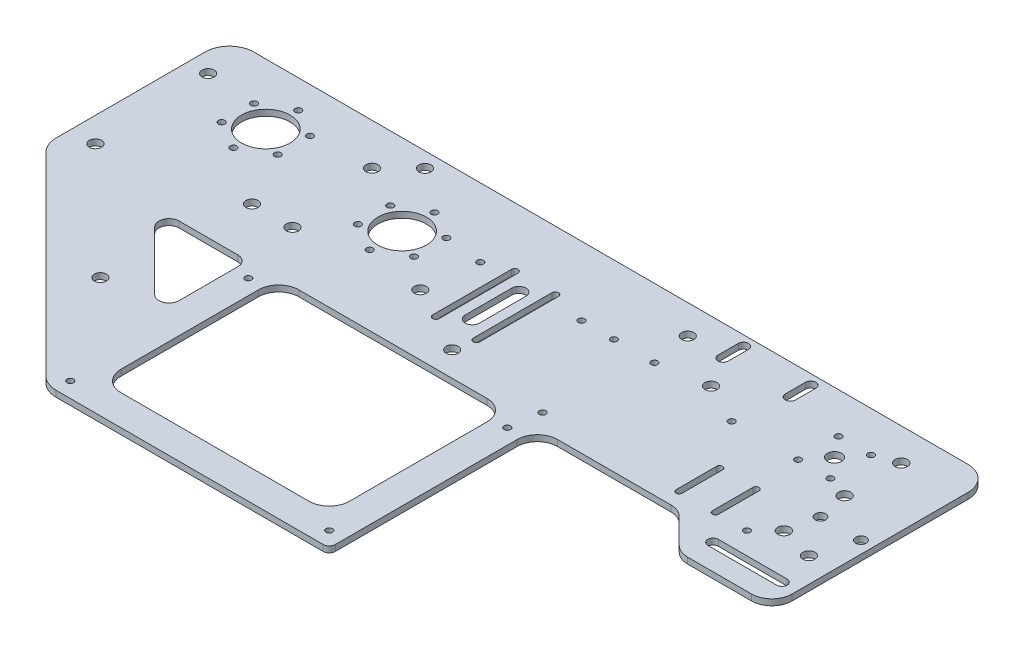
from build123d import *

# Parameters (mm, degrees)
ESBO_O1_R                = 1.6
ESBO_O1_R_2              = 3
ESBO_O1_R_3              = 12
ESBO_O1_R_4              = 3.5
ESBO_O1_R_5              = 3.05
RESSALTO_EXTRUS_O1_DEPTH = 3
ESBO_O2_R                = 3
ESBO_O2_R_2              = 2.6
CORTE_EXTRUS_O1_DEPTH    = 10
RESSALTO_EXTRUS_O2_START = -3
RESSALTO_EXTRUS_O2_DEPTH = 3
FILETE1_R                = 10
CORTE_EXTRUS_O2_DEPTH    = 244.227671166


# Read off the part's stored shape, not the designer's step: Ressalto-extrusão2
with BuildPart() as part:
    # Esboço1 → Ressalto-extrusão1 (new body)
    with BuildSketch(Plane(origin=(0, 0, 0), x_dir=(1, 0, 0), z_dir=(0, 1, 0))):
        with BuildLine():
            Line((-80.557360207, -153.648697641), (51.472077044, -153.648697641))
            ThreePointArc((51.472077044, -153.648697641), (53.593397388, -152.770017984), (54.472077044, -150.648697641))
            Line((54.472077044, -150.648697641), (54.472077044, -60.788592817))
            ThreePointArc((54.472077044, -60.788592817), (57.401009232, -53.717525005), (64.472077044, -50.788592817))
            Line((64.472077044, -50.788592817), (178.527922956, -50.788592817))
            ThreePointArc((178.527922956, -50.788592817), (185.598990768, -47.859660628), (188.527922956, -40.788592817))
            Line((188.527922956, -40.788592817), (188.527922956, 28))
            ThreePointArc((188.527922956, 28), (185.01320433, 36.485281374), (176.527922956, 40))
            Line((176.527922956, 40), (-176.527922956, 40))
            ThreePointArc((-176.527922956, 40), (-185.01320433, 36.485281374), (-188.527922956, 28))
            Line((-188.527922956, 28), (-188.527922956, -45.678134892))
            ThreePointArc((-188.527922956, -45.678134892), (-187.614477346, -50.270336081), (-185.01320433, -54.163416267))
            Line((-185.01320433, -54.163416267), (-89.042641582, -150.133979015))
            ThreePointArc((-89.042641582, -150.133979015), (-85.149561396, -152.735252031), (-80.557360207, -153.648697641))
        make_face()
        with Locations(Location((-81.027922956, -58.148697641, 0), (0, 0, 90))):
            Circle(ESBO_O1_R, mode=Mode.SUBTRACT)
        with Locations(Location((-81.027922956, -146.148697641, 0), (0, 0, 90))):
            Circle(ESBO_O1_R, mode=Mode.SUBTRACT)
        with Locations(Location((46.972077044, -58.148697641, 0), (0, 0, 90))):
            Circle(ESBO_O1_R, mode=Mode.SUBTRACT)
        with Locations(Location((46.972077044, -146.148697641, 0), (0, 0, 90))):
            Circle(ESBO_O1_R, mode=Mode.SUBTRACT)
        with Locations(Location((176.311042956, -38.431817641, 0), (0, 0, 90))):
            Circle(ESBO_O1_R_2, mode=Mode.SUBTRACT)
        with Locations(Location((0, -38.431817641, 0), (0, 0, 90))):
            Circle(ESBO_O1_R_2, mode=Mode.SUBTRACT)
        with Locations(Location((-140.527922956, 10, 0), (0, 0, 90))):
            Circle(ESBO_O1_R_3, mode=Mode.SUBTRACT)
        with Locations(Location((-140.527922956, -6, 0), (0, 0, 270))):
            Circle(ESBO_O1_R, mode=Mode.SUBTRACT)
        with Locations(Location((-154.384329416, 2, 0), (0, 0, 270))):
            Circle(ESBO_O1_R, mode=Mode.SUBTRACT)
        with Locations(Location((-154.384329416, 18, 0), (0, 0, 270))):
            Circle(ESBO_O1_R, mode=Mode.SUBTRACT)
        with Locations(Location((-84.367438628, 32.5, 0), (0, 0, 90))):
            Circle(ESBO_O1_R_2, mode=Mode.SUBTRACT)
        with Locations(Location((-176.311042956, -38.431817641, 0), (0, 0, 90))):
            Circle(ESBO_O1_R_2, mode=Mode.SUBTRACT)
        with Locations(Location((140.527922956, 10, 0), (0, 0, 90))):
            Circle(ESBO_O1_R_4, mode=Mode.SUBTRACT)
        with Locations(Location((148.527922956, 0, 0), (0, 0, 90))):
            Circle(ESBO_O1_R, mode=Mode.SUBTRACT)
        with Locations(Location((148.527922956, 20, 0), (0, 0, 90))):
            Circle(ESBO_O1_R, mode=Mode.SUBTRACT)
        with Locations(Location((132.527922956, 0, 0), (0, 0, 90))):
            Circle(ESBO_O1_R, mode=Mode.SUBTRACT)
        with Locations(Location((132.527922956, 20, 0), (0, 0, 90))):
            Circle(ESBO_O1_R, mode=Mode.SUBTRACT)
        with Locations(Location((-140.527922956, 26, 0), (0, 0, 270))):
            Circle(ESBO_O1_R, mode=Mode.SUBTRACT)
        with Locations(Location((-126.671516495, 18, 0), (0, 0, 270))):
            Circle(ESBO_O1_R, mode=Mode.SUBTRACT)
        with Locations(Location((-126.671516495, 2, 0), (0, 0, 270))):
            Circle(ESBO_O1_R, mode=Mode.SUBTRACT)
        with Locations(Location((-63.17160518, -16, 0), (0, 0, 270))):
            Circle(ESBO_O1_R, mode=Mode.SUBTRACT)
        with Locations(Location((-77.02801164, -8, 0), (0, 0, 270))):
            Circle(ESBO_O1_R, mode=Mode.SUBTRACT)
        with Locations(Location((-77.02801164, 8, 0), (0, 0, 270))):
            Circle(ESBO_O1_R, mode=Mode.SUBTRACT)
        with Locations(Location((-63.17160518, 16, 0), (0, 0, 270))):
            Circle(ESBO_O1_R, mode=Mode.SUBTRACT)
        with Locations(Location((-49.315198719, 8, 0), (0, 0, 270))):
            Circle(ESBO_O1_R, mode=Mode.SUBTRACT)
        with Locations(Location((-49.315198719, -8, 0), (0, 0, 270))):
            Circle(ESBO_O1_R, mode=Mode.SUBTRACT)
        with Locations(Location((-63.17160518, 0, 0), (0, 0, 270))):
            Circle(ESBO_O1_R_3, mode=Mode.SUBTRACT)
        with Locations(Location((-33.527922956, -20.648697641, 0), (0, 0, 270))):
            Circle(ESBO_O1_R_2, mode=Mode.SUBTRACT)
        with Locations(Location((79.527922956, 10, 0), (0, 0, 270))):
            Circle(ESBO_O1_R_2, mode=Mode.SUBTRACT)
        with Locations(Location((99.722077044, 0, 0), (0, 0, 270))):
            Circle(ESBO_O1_R, mode=Mode.SUBTRACT)
        with Locations(Location((49.222077044, -43, 0), (0, 0, 270))):
            Circle(ESBO_O1_R, mode=Mode.SUBTRACT)
        with Locations(Location((-30.527922956, 6, 0), (0, 0, 270))):
            Circle(ESBO_O1_R, mode=Mode.SUBTRACT)
        with Locations(Location((19.472077044, 6, 0), (0, 0, 270))):
            Circle(ESBO_O1_R, mode=Mode.SUBTRACT)
        with Locations(Location((55.527922956, 6, 0), (0, 0, 270))):
            Circle(ESBO_O1_R, mode=Mode.SUBTRACT)
        with Locations(Location((35.527922956, 6, 0), (0, 0, 270))):
            Circle(ESBO_O1_R, mode=Mode.SUBTRACT)
        with Locations(Location((159.467922956, 24.07, 0), (0, 0, 270))):
            Circle(ESBO_O1_R_5, mode=Mode.SUBTRACT)
        with Locations(Location((159.467922956, -3.93, 0), (0, 0, 270))):
            Circle(ESBO_O1_R_5, mode=Mode.SUBTRACT)
        with Locations(Location((159.467922956, -33.93, 0), (0, 0, 270))):
            Circle(ESBO_O1_R_5, mode=Mode.SUBTRACT)
        with Locations(Location((-178.527922956, 19.5, 0), (0, 0, 270))):
            Circle(ESBO_O1_R_2, mode=Mode.SUBTRACT)
        with Locations(Location((-97.527922956, 19.5, 0), (0, 0, 270))):
            Circle(ESBO_O1_R_2, mode=Mode.SUBTRACT)
        with Locations(Location((52.327922956, 25.68, 0), (0, 0, 270))):
            Circle(ESBO_O1_R_2, mode=Mode.SUBTRACT)
        with Locations(Location((150.222077044, -43, 0), (0, 0, 270))):
            Circle(ESBO_O1_R, mode=Mode.SUBTRACT)
        with BuildLine():
            Line((-122.576844598, -50.788592817), (-93.527922956, -50.788592817))
            ThreePointArc((-93.527922956, -50.788592817), (-89.99238905, -52.253058911), (-88.527922956, -55.788592817))
            Line((-88.527922956, -55.788592817), (-88.527922956, -84.837514459))
            ThreePointArc((-88.527922956, -84.837514459), (-91.614505794, -89.456912121), (-97.063456862, -88.373048365))
            Line((-97.063456862, -88.373048365), (-126.112378504, -59.324126723))
            ThreePointArc((-126.112378504, -59.324126723), (-127.196242261, -53.875175655), (-122.576844598, -50.788592817))
        make_face(mode=Mode.SUBTRACT)
        with BuildLine():
            Line((39.472077044, -60.648697641), (39.472077044, -128.648697641))
            ThreePointArc((39.472077044, -128.648697641), (36.543144856, -135.719765453), (29.472077044, -138.648697641))
            Line((29.472077044, -138.648697641), (-63.527922956, -138.648697641))
            ThreePointArc((-63.527922956, -138.648697641), (-70.598990768, -135.719765453), (-73.527922956, -128.648697641))
            Line((-73.527922956, -128.648697641), (-73.527922956, -60.648697641))
            ThreePointArc((-73.527922956, -60.648697641), (-70.598990768, -53.577629829), (-63.527922956, -50.648697641))
            Line((-63.527922956, -50.648697641), (29.472077044, -50.648697641))
            ThreePointArc((29.472077044, -50.648697641), (36.543144856, -53.577629829), (39.472077044, -60.648697641))
        make_face(mode=Mode.SUBTRACT)
        with BuildLine():
            Line((133.222077044, -43), (133.222077044, -23))
            ThreePointArc((133.222077044, -23), (134.722077044, -21.5), (136.222077044, -23))
            Line((136.222077044, -23), (136.222077044, -43))
            ThreePointArc((136.222077044, -43), (134.722077044, -44.5), (133.222077044, -43))
        make_face(mode=Mode.SUBTRACT)
        with BuildLine():
            Line((118.222077044, -43), (118.222077044, -23))
            ThreePointArc((118.222077044, -23), (116.722077044, -21.5), (115.222077044, -23))
            Line((115.222077044, -23), (115.222077044, -43))
            ThreePointArc((115.222077044, -43), (116.722077044, -44.5), (118.222077044, -43))
        make_face(mode=Mode.SUBTRACT)
        with BuildLine():
            Line((67.977922956, 25), (67.977922956, 35))
            ThreePointArc((67.977922956, 35), (70.527922956, 37.55), (73.077922956, 35))
            Line((73.077922956, 35), (73.077922956, 25))
            ThreePointArc((73.077922956, 25), (70.527922956, 22.45), (67.977922956, 25))
        make_face(mode=Mode.SUBTRACT)
        with BuildLine():
            Line((101.227922956, 25), (101.227922956, 35))
            ThreePointArc((101.227922956, 35), (103.777922956, 37.55), (106.327922956, 35))
            Line((106.327922956, 35), (106.327922956, 25))
            ThreePointArc((106.327922956, 25), (103.777922956, 22.45), (101.227922956, 25))
        make_face(mode=Mode.SUBTRACT)
    extrude(amount=-RESSALTO_EXTRUS_O1_DEPTH)

    # Esboço2 → Corte-extrusão1 (cut)
    with BuildSketch(Plane(origin=(0, 0, 0), x_dir=(1, 0, 0), z_dir=(0, 1, 0))):
        with Locations(Location((-117.838060117, -94.468502794, 0), (0, 0, 270))):
            Circle(ESBO_O2_R)
        with Locations(Location((182.527922956, -18.93, 0), (0, 0, 270))):
            Circle(ESBO_O2_R_2)
        with Locations(Location((162.527922956, -18.93, 0), (0, 0, 270))):
            Circle(ESBO_O2_R_2)
        with Locations(Location((-111.849764068, -25.5, 0), (0, 0, 270))):
            Circle(ESBO_O2_R)
        with Locations(Location((-91.849764068, -25.5, 0), (0, 0, 270))):
            Circle(ESBO_O2_R)
    extrude(amount=-CORTE_EXTRUS_O1_DEPTH, mode=Mode.SUBTRACT)

    # Ressalto-extrusão2 outline → Ressalto-extrusão2 (add)
    with BuildSketch(Plane(origin=(0, 0, 0), x_dir=(1, 0, 0), z_dir=(0, 1, 0)).offset(RESSALTO_EXTRUS_O2_START)):
        with BuildLine():
            Line((142.785787332, -68.988592817), (188.527922956, -68.988592817))
            Line((188.527922956, -68.988592817), (188.527922956, -40.788592817))
            ThreePointArc((188.527922956, -40.788592817), (185.598990767, -47.859660628), (178.527922956, -50.788592817))
            Line((178.527922956, -50.788592817), (124.585787332, -50.788592817))
            Line((124.585787332, -50.788592817), (142.785787332, -68.988592817))
        make_face()
        with BuildLine():
            ThreePointArc((146.927922956, -58.988592817), (144.327922956, -56.388592817), (146.927922956, -53.788592817))
            Line((146.927922956, -53.788592817), (180.927922956, -53.788592817))
            ThreePointArc((180.927922956, -53.788592817), (183.527922956, -56.388592817), (180.927922956, -58.988592817))
            Line((180.927922956, -58.988592817), (146.927922956, -58.988592817))
        make_face(mode=Mode.SUBTRACT)
    extrude(amount=RESSALTO_EXTRUS_O2_DEPTH)

    # Filete1
    filete1_edges = [part.edges().sort_by_distance(p)[0] for p in [
        (124.585787332, -1.5, 50.788592817),
        (188.527922956, -1.5, 68.988592817),
        (142.785787332, -1.5, 68.988592817),
    ]]
    fillet(filete1_edges, radius=FILETE1_R)

    # Esboço4 → Corte-extrusão2 (cut, through all)
    with BuildSketch(Plane(origin=(0, 0, 0), x_dir=(1, 0, 0), z_dir=(0, 1, 0))):
        with BuildLine():
            Line((-4.67160518, 2.700055346), (-4.67160518, -20.299944654))
            ThreePointArc((-4.67160518, -20.299944654), (-8.17160518, -23.799944654), (-11.67160518, -20.299944654))
            Line((-11.67160518, -20.299944654), (-11.67160518, 2.700055346))
            ThreePointArc((-11.67160518, 2.700055346), (-8.17160518, 6.200055346), (-4.67160518, 2.700055346))
        make_face()
        with BuildLine():
            Line((3.42839482, 10.700055346), (3.42839482, -12.299944654))
            ThreePointArc((3.42839482, -12.299944654), (1.82839482, -13.899944654), (0.22839482, -12.299944654))
            Line((0.22839482, -12.299944654), (0.22839482, 10.700055346))
            ThreePointArc((0.22839482, 10.700055346), (1.82839482, 12.300055346), (3.42839482, 10.700055346))
        make_face()
        with BuildLine():
            Line((3.42839482, -5.299944654), (3.42839482, -28.299944654))
            ThreePointArc((3.42839482, -28.299944654), (1.82839482, -29.899944654), (0.22839482, -28.299944654))
            Line((0.22839482, -28.299944654), (0.22839482, -5.299944654))
            ThreePointArc((0.22839482, -5.299944654), (1.82839482, -3.699944654), (3.42839482, -5.299944654))
        make_face()
        with BuildLine():
            Line((-19.77160518, -5.299944654), (-19.77160518, -28.299944654))
            ThreePointArc((-19.77160518, -28.299944654), (-18.17160518, -29.899944654), (-16.57160518, -28.299944654))
            Line((-16.57160518, -28.299944654), (-16.57160518, -5.299944654))
            ThreePointArc((-16.57160518, -5.299944654), (-18.17160518, -3.699944654), (-19.77160518, -5.299944654))
        make_face()
        with BuildLine():
            Line((-19.77160518, 10.700055346), (-19.77160518, -12.299944654))
            ThreePointArc((-19.77160518, -12.299944654), (-18.17160518, -13.899944654), (-16.57160518, -12.299944654))
            Line((-16.57160518, -12.299944654), (-16.57160518, 10.700055346))
            ThreePointArc((-16.57160518, 10.700055346), (-18.17160518, 12.300055346), (-19.77160518, 10.700055346))
        make_face()
    extrude(amount=-CORTE_EXTRUS_O2_DEPTH, mode=Mode.SUBTRACT)


solid = part.part
